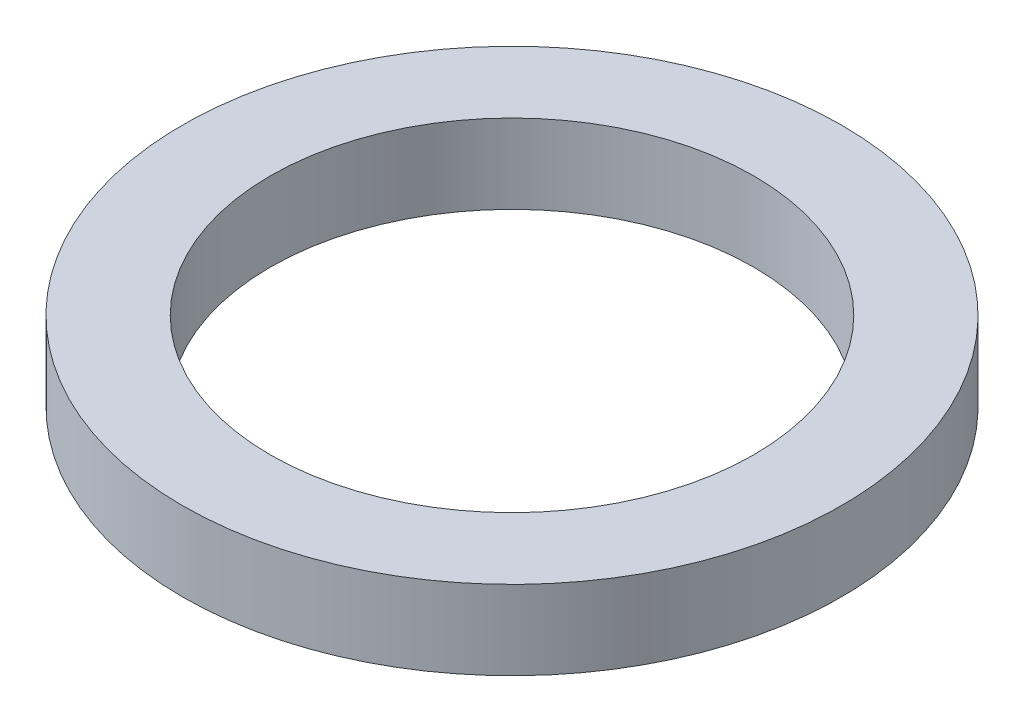
from build123d import *

# Parameters (mm, degrees)
SKETCH1_R           = 37.5
BOSS_EXTRUDE1_DEPTH = 9
SKETCH2_R           = 27.5
CUT_EXTRUDE1_DEPTH  = 54.791263231


with BuildPart() as part:
    # Sketch1 → Boss-Extrude1 (new body)
    with BuildSketch(Plane(origin=(0, 0, 0), x_dir=(1, 0, 0), z_dir=(0, 1, 0))):
        Circle(SKETCH1_R)
    extrude(amount=BOSS_EXTRUDE1_DEPTH)

    # Sketch2 → Cut-Extrude1 (cut, through all)
    with BuildSketch(Plane(origin=(0, 0, 0), x_dir=(1, 0, 0), z_dir=(0, 1, 0))):
        Circle(SKETCH2_R)
    extrude(amount=CUT_EXTRUDE1_DEPTH, mode=Mode.SUBTRACT)


solid = part.part
